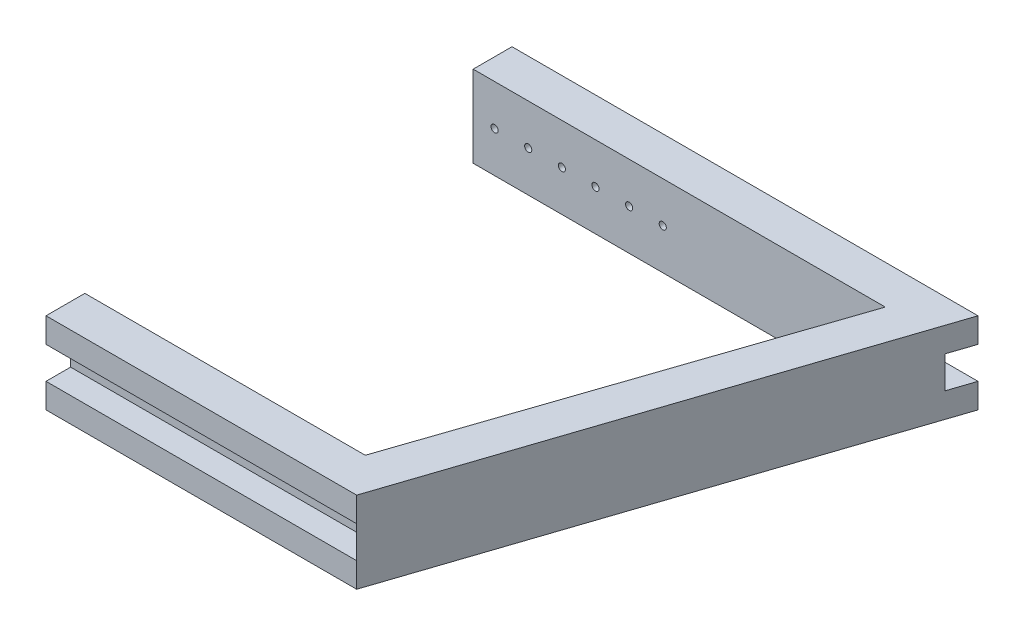
from build123d import *

# Parameters (mm, degrees)
BOSS_EXTRUDE1_DEPTH = 80.000094
SKETCH2_W           = 304.8
SKETCH2_H           = 31.384494
CUT_EXTRUDE1_DEPTH  = 24.12000002
SKETCH3_W           = 457.2
SKETCH3_H           = 31.384494
CUT_EXTRUDE2_DEPTH  = 24.12000002
SKETCH4_R           = 3.5000057
CUT_EXTRUDE3_DEPTH  = 497.201835368
SKETCH6_W           = 402.301517202
SKETCH6_H           = 31.384494
CUT_EXTRUDE4_DEPTH  = 24.12000002
SKETCH7_W           = 140.152117341
SKETCH7_H           = 59.36000066
CUT_EXTRUDE5_DEPTH  = 30.48


with BuildPart() as part:
    # Sketch1 → Boss-Extrude1 (new body)
    with BuildSketch(Plane(origin=(0, 0, 0), x_dir=(1, 0, 0), z_dir=(0, 1, 0))):
        Polygon((-228.6, 0), (228.6, 0), (76.2, -457.2), (-228.6, -457.2), (-228.6, -419.1), (46.566666667, -419.1), (175.739073716, -38.1), (-228.6, -38.1), align=None)
    extrude(amount=BOSS_EXTRUDE1_DEPTH)

    # Sketch2 → Cut-Extrude1 (cut)
    with BuildSketch(Plane.XY.offset(457.2)):
        with Locations((-76.2, 40.000047)):
            Rectangle(SKETCH2_W, SKETCH2_H)
    extrude(amount=-CUT_EXTRUDE1_DEPTH, mode=Mode.SUBTRACT)

    # Sketch3 → Cut-Extrude2 (cut)
    with BuildSketch(Plane(origin=(0, 0, 0), x_dir=(-1, 0, 0), z_dir=(0, 0, -1))):
        with Locations((0, 40.000047)):
            Rectangle(SKETCH3_W, SKETCH3_H)
    extrude(amount=-CUT_EXTRUDE2_DEPTH, mode=Mode.SUBTRACT)

    # Sketch4 → Cut-Extrude3 (cut, through all)
    with BuildSketch(Plane.XY.offset(433.07999998)):
        with Locations((-207.5999912, 40.000047)):
            Circle(SKETCH4_R)
        with Locations((-174.6000572, 40.000047)):
            Circle(SKETCH4_R)
        with Locations((-141.6001232, 40.000047)):
            Circle(SKETCH4_R)
        with Locations((-108.6001892, 40.000047)):
            Circle(SKETCH4_R)
        with Locations((-75.6002552, 40.000047)):
            Circle(SKETCH4_R)
        with Locations((-42.6003212, 40.000047)):
            Circle(SKETCH4_R)
    extrude(amount=-CUT_EXTRUDE3_DEPTH, mode=Mode.SUBTRACT)

    # Sketch6 → Cut-Extrude4 (cut)
    with BuildSketch(Plane(origin=(169.206856125, 0, 57.367078464), x_dir=(-0.3210835692284878, 0, 0.9470508653559718), z_dir=(-0.9470508653559717, 0, -0.32108356922848774))):
        with Locations((180.806467529, 40.000047)):
            Rectangle(SKETCH6_W, SKETCH6_H)
    extrude(amount=-CUT_EXTRUDE4_DEPTH, mode=Mode.SUBTRACT)

    # Sketch7 → Cut-Extrude5 (cut)
    with BuildSketch(Plane(origin=(169.206856125, 0, 57.367078464), x_dir=(-0.3210835692284878, 0, 0.9470508653559718), z_dir=(-0.9470508653559717, 0, -0.32108356922848774))):
        with Locations((74.731768399, 40.00769367)):
            Rectangle(SKETCH7_W, SKETCH7_H)
    extrude(amount=-CUT_EXTRUDE5_DEPTH, mode=Mode.SUBTRACT)


solid = part.part
